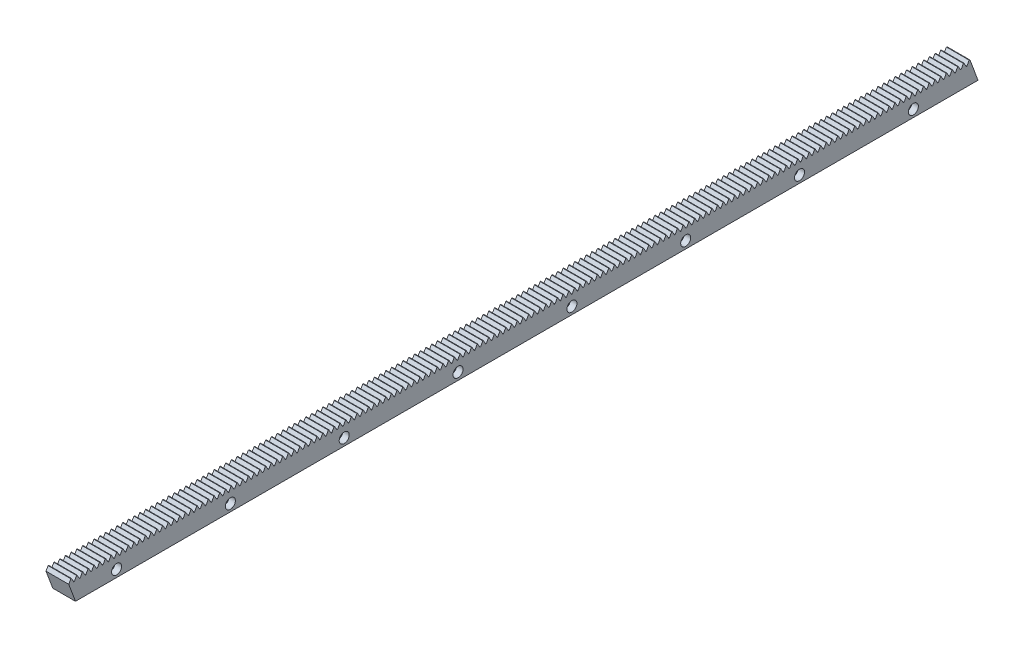
from build123d import *

# Parameters (mm, degrees)
SKETCH_1_W                = 1000
SKETCH_1_H                = 24
EXTRUDE_1_DEPTH           = 12.5
CUT_EXTRUDE_1_DEPTH       = 1001.366058001
PATTERN_LINEAR_3_COUNT    = 160
PATTERN_LINEAR_3_PITCH    = 6.283
CUT_EXTRUDE_2_DEPTH       = 1001.600319808
HOLE_WIZARD_1_D           = 7
HOLE_WIZARD_1_CBORE_D     = 11
HOLE_WIZARD_1_CBORE_DEPTH = 7
PATTERN_LINEAR_4_COUNT    = 8
PATTERN_LINEAR_4_PITCH    = 125


with BuildPart() as part:
    # 草图1 → 凸台-拉伸1 (new, symmetric)
    with BuildSketch(Plane(origin=(0, 0, 0), x_dir=(0, 0, -1), z_dir=(1, 0, 0))):
        with Locations((-500, 12)):
            Rectangle(SKETCH_1_W, SKETCH_1_H)
    extrude(amount=EXTRUDE_1_DEPTH, both=True)

    # 草图2 → 切除-拉伸1 (cut, symmetric)
    with BuildSketch(Plane(origin=(0, 0, 0), x_dir=(0, 0, -1), z_dir=(1, 0, 0))):
        Polygon((-2.82735, 26), (-2.82735, 24), (-0.31415, 19.5), (0.31415, 19.5), (2.82735, 24), (2.82735, 26), align=None)
    cut_extrude_1 = extrude(amount=CUT_EXTRUDE_1_DEPTH, both=True, mode=Mode.SUBTRACT)

    # 阵列(线性)3: 切除-拉伸1 ×160
    with Locations(*[(0, 0, i * PATTERN_LINEAR_3_PITCH) for i in range(1, PATTERN_LINEAR_3_COUNT)]):
        add(cut_extrude_1, mode=Mode.SUBTRACT)

    # 草图6 → 切除-拉伸2 (cut, through all)
    with BuildSketch(Plane(origin=(12.5, 0, 0), x_dir=(0, 0, -1), z_dir=(1, 0, 0))):
        Polygon((-1000, 24), (-991.1, 0), (-1000, 0), align=None)
        Polygon((0, 24), (-8.9, 24), (0, 0), align=None)
    extrude(amount=-CUT_EXTRUDE_2_DEPTH, mode=Mode.SUBTRACT)

    # 打孔尺寸根据内六角圆柱头螺钉的类型1 (through all)
    with Locations(Plane(origin=(12.5, 0, 0), x_dir=(0, 0, -1), z_dir=(1, 0, 0))):
        with Locations((-70.984319305, 8)):
            hole_wizard_1 = CounterBoreHole(HOLE_WIZARD_1_D / 2, HOLE_WIZARD_1_CBORE_D / 2, HOLE_WIZARD_1_CBORE_DEPTH)

    # 阵列(线性)4: 打孔尺寸根据内六角圆柱头螺钉的类型1 ×8
    with Locations(*[(0, 0, i * PATTERN_LINEAR_4_PITCH) for i in range(1, PATTERN_LINEAR_4_COUNT)]):
        add(hole_wizard_1, mode=Mode.SUBTRACT)


solid = part.part
